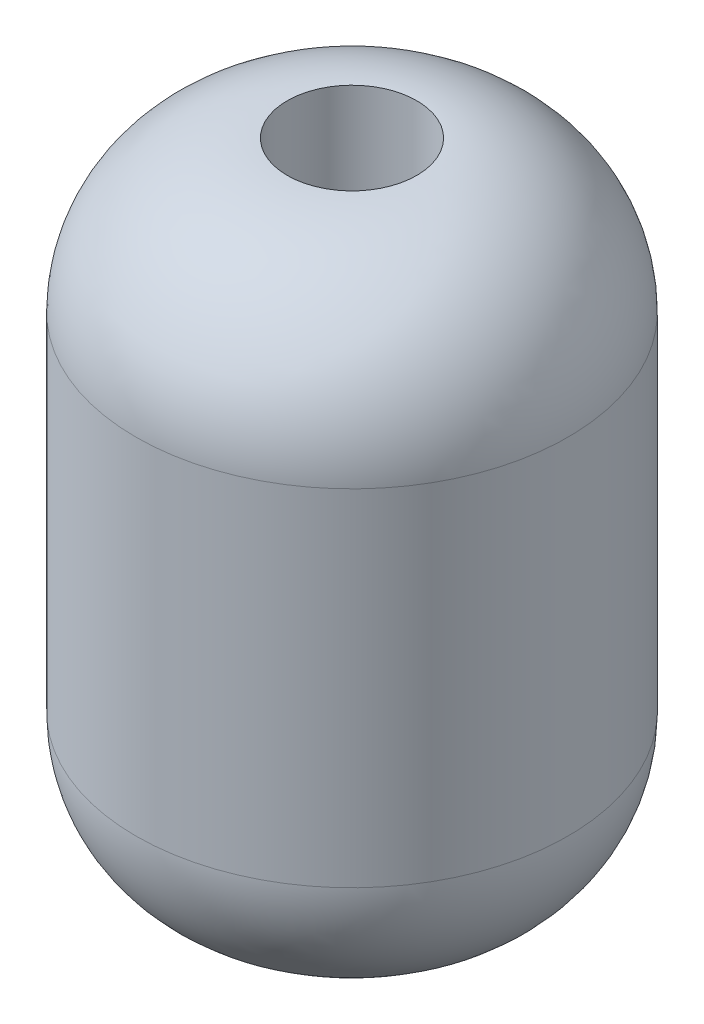
from build123d import *

# Parameters (mm, degrees)
ESQUISSE2_R        = 2
ESQUISSE2_R_2      = 0.6
BOSS_EXTRU_1_DEPTH = 6
CONG_1_R           = 1.4


with BuildPart() as part:
    # Esquisse2 → Boss.-Extru.1 (new body)
    with BuildSketch(Plane(origin=(0, 0, 0), x_dir=(1, 0, 0), z_dir=(0, 1, 0))):
        with Locations(Location((0, 0, 0), (0, 0, 270))):
            Circle(ESQUISSE2_R)
        with Locations(Location((0, 0, 0), (0, 0, 270))):
            Circle(ESQUISSE2_R_2, mode=Mode.SUBTRACT)
    extrude(amount=BOSS_EXTRU_1_DEPTH)

    # Congé1
    cong_1_edges = [part.edges().sort_by_distance(p)[0] for p in [
        (0, 0, -2),
        (0, 6, -2),
    ]]
    fillet(cong_1_edges, radius=CONG_1_R - 0.0001)  # a hair under: the kernel refuses the full size


solid = part.part
